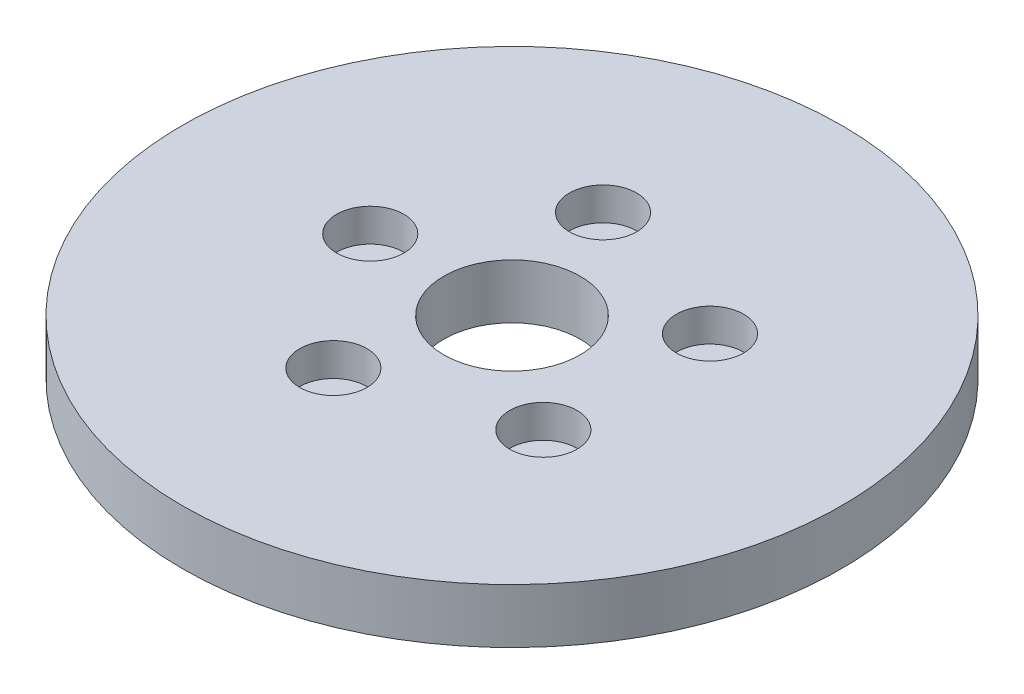
from build123d import *

# Parameters (mm, degrees)
SKETCH1_R           = 72.5
BOSS_EXTRUDE1_DEPTH = 12
SKETCH2_R           = 15
CUT_EXTRUDE1_DEPTH  = 104.230325002
SKETCH3_R           = 7.402545608
CUT_EXTRUDE2_DEPTH  = 7.222978458
CIRPATTERN1_COUNT   = 5


with BuildPart() as part:
    # Sketch1 → Boss-Extrude1 (new body)
    with BuildSketch(Plane(origin=(0, 0, 0), x_dir=(1, 0, 0), z_dir=(0, 1, 0))):
        Circle(SKETCH1_R)
    extrude(amount=BOSS_EXTRUDE1_DEPTH)

    # Sketch2 → Cut-Extrude1 (cut, through all)
    with BuildSketch(Plane(origin=(0, 0, 0), x_dir=(1, 0, 0), z_dir=(0, 1, 0))):
        Circle(SKETCH2_R)
    extrude(amount=CUT_EXTRUDE1_DEPTH, mode=Mode.SUBTRACT)

    # Sketch3 → Cut-Extrude2 (cut)
    with BuildSketch(Plane(origin=(0, 12, 0), x_dir=(1, 0, 0), z_dir=(0, 1, 0))):
        with Locations((-31.185630014, 0)):
            Circle(SKETCH3_R)
    cut_extrude2 = extrude(amount=-CUT_EXTRUDE2_DEPTH, mode=Mode.SUBTRACT)

    # CirPattern1: Cut-Extrude2 ×5 about axis
    cirpattern1_axis = Axis((0, 0, 0), (0, 1, 0))
    for i in range(1, CIRPATTERN1_COUNT):
        add(cut_extrude2.rotate(cirpattern1_axis, i * 360 / CIRPATTERN1_COUNT), mode=Mode.SUBTRACT)


solid = part.part
